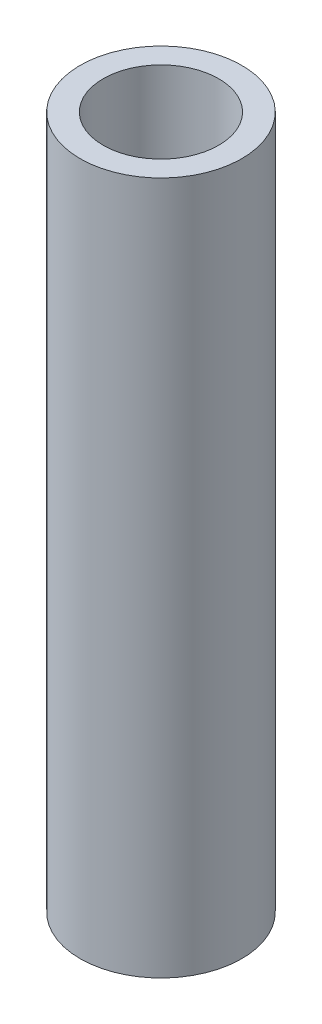
from build123d import *

# Parameters (mm, degrees)
SKETCH1_R           = 44.45
SKETCH1_R_2         = 31.75
BOSS_EXTRUDE1_DEPTH = 381


with BuildPart() as part:
    # Sketch1 → Boss-Extrude1 (new body)
    with BuildSketch(Plane(origin=(0, 0, 0), x_dir=(1, 0, 0), z_dir=(0, 1, 0))):
        Circle(SKETCH1_R)
        Circle(SKETCH1_R_2, mode=Mode.SUBTRACT)
    extrude(amount=BOSS_EXTRUDE1_DEPTH)


solid = part.part
